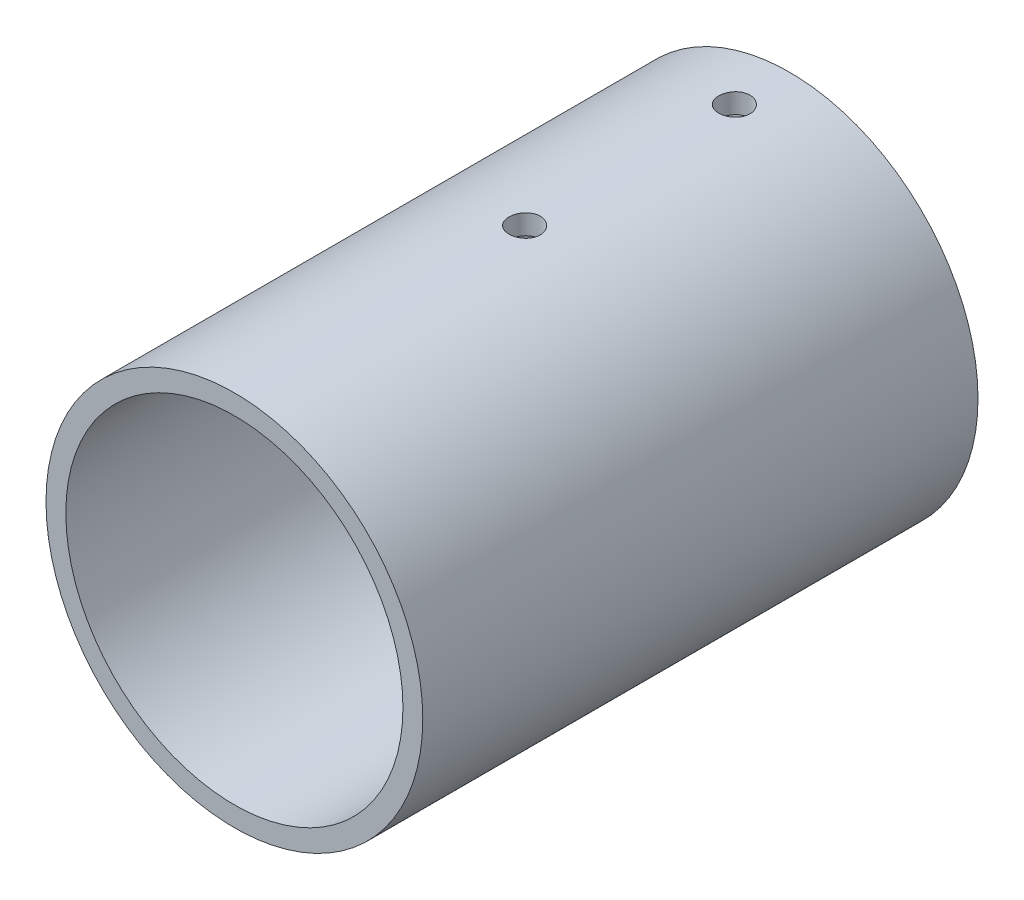
from build123d import *

# Parameters (mm, degrees)
SKETCH1_R               = 60.325
BOSS_EXTRUDE1_DEPTH     = 177.8
SKETCH2_R               = 31.75
CUT_EXTRUDE1_DEPTH      = 198.208141947
SKETCH3_R               = 53.975
CUT_EXTRUDE2_DEPTH      = 165.1
CUT_EXTRUDE5_DEPTH      = 198.208141947
CUT_EXTRUDE5_DEPTH_BACK = 198.208141947
SKETCH8_R               = 5


with BuildPart() as part:
    # Sketch1 → Boss-Extrude1 (new body)
    with BuildSketch(Plane.XY):
        Circle(SKETCH1_R)
    extrude(amount=BOSS_EXTRUDE1_DEPTH)

    # Sketch2 → Cut-Extrude1 (cut, through all)
    with BuildSketch(Plane.XY.offset(177.8)):
        Circle(SKETCH2_R)
    extrude(amount=-CUT_EXTRUDE1_DEPTH, mode=Mode.SUBTRACT)

    # Sketch3 → Cut-Extrude2 (cut)
    with BuildSketch(Plane.XY.offset(177.8)):
        Circle(SKETCH3_R)
    extrude(amount=-CUT_EXTRUDE2_DEPTH, mode=Mode.SUBTRACT)

    # Sketch8 → Cut-Extrude5 (cut, two sides: drawn at the far end of the back side and taken through both)
    with BuildSketch(Plane(origin=(0, 0, 0), x_dir=(1, 0, 0), z_dir=(0, 1, 0)).offset(-CUT_EXTRUDE5_DEPTH_BACK)):
        with Locations((0, -17.7)):
            Circle(SKETCH8_R)
        with Locations((0, -84.85)):
            Circle(SKETCH8_R)
    extrude(amount=CUT_EXTRUDE5_DEPTH + CUT_EXTRUDE5_DEPTH_BACK, mode=Mode.SUBTRACT)


solid = part.part
